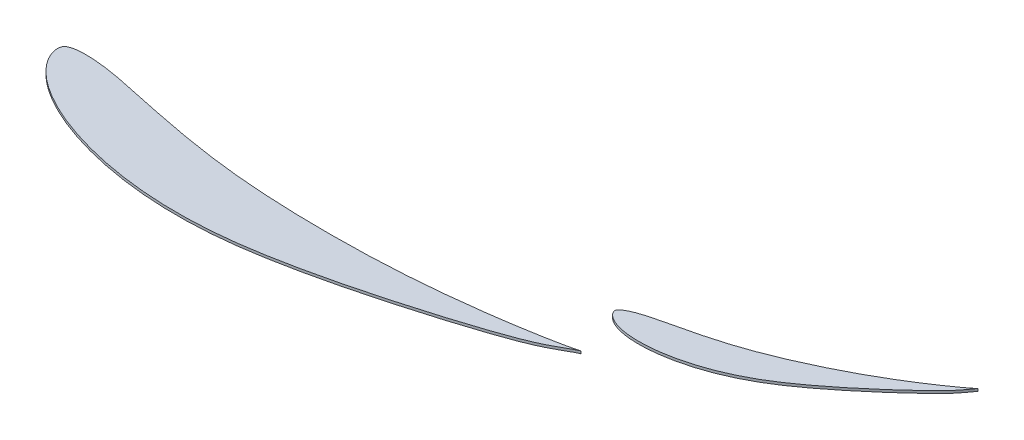
from build123d import *

# Parameters (mm, degrees)
BOSS_EXTRUDE1_DEPTH   = 2.54
BOSS_EXTRUDE1_2_DEPTH = 2.54


with BuildPart() as part:
    # Sketch1 → Boss-Extrude1 (new body)
    with BuildSketch(Plane(origin=(0, 0, 0), x_dir=(1, 0, 0), z_dir=(0, 1, 0))):
        with BuildLine():
            add(Edge.make_bspline(
                [(-65.525015137, 39.103844496), (-65.514133524, 39.05568373), (-69.330368116, 37.456695765), (-72.814827737, 35.400024606), (-80.7227079, 31.037480072), (-89.868707645, 26.057957443), (-101.665412949, 20.744641968), (-115.688692878, 15.412422669), (-131.983798166, 9.738777373), (-150.313770939, 3.751195379), (-170.420335762, -2.473211736), (-192.000742616, -8.83201937), (-214.756030556, -15.180686699), (-238.376616433, -21.382100922), (-262.560241869, -27.266919104), (-287.016180304, -32.63849534), (-311.456806383, -37.330221388), (-335.682843204, -41.100750357), (-359.591860952, -43.613190616), (-383.094018703, -44.822981977), (-406.104811997, -44.756753522), (-428.500260401, -43.467406892), (-450.149778579, -41.017205717), (-470.899931906, -37.493694507), (-490.597023577, -33.054648174), (-509.06491684, -27.812624595), (-526.129146123, -21.866271872), (-541.640457533, -15.334526653), (-555.466097949, -8.336922294), (-567.501002357, -1.005045574), (-577.656092521, 6.520797485), (-585.877200668, 14.082583746), (-592.133317539, 21.499736096), (-596.409495562, 28.59061136), (-598.575034728, 34.696788924), (-599.036000502, 38.911936925), (-598.790413989, 41.126303201), (-598.555902064, 42.207349962), (-598.30730175, 42.909543057), (-598.080648678, 43.431116307), (-597.879433561, 43.785850019), (-597.652549225, 44.115936175), (-597.368372032, 44.407883099), (-597.045817309, 44.681617567), (-596.556272794, 45.055826532), (-595.837030303, 45.476337957), (-594.68549791, 46.033652822), (-593.266785111, 46.559481046), (-589.524443937, 47.654977767), (-582.558240804, 48.420263236), (-571.538992553, 48.268320916), (-557.678707228, 46.802932901), (-540.902385572, 44.032003196), (-521.043703025, 39.934043609), (-497.975364102, 34.853408208), (-471.685857532, 29.503363101), (-442.487304973, 24.368315862), (-410.919097148, 19.902914985), (-377.698542245, 16.696153664), (-343.690278224, 14.870289275), (-309.66285138, 14.102695154), (-276.182981555, 14.264075254), (-243.757756932, 15.306649484), (-212.926276636, 17.226115366), (-184.210496541, 19.836057189), (-158.045252033, 22.833186658), (-134.732605243, 26.001109907), (-114.610260362, 29.129387533), (-97.62674733, 32.094851308), (-84.629317955, 34.52359059), (-74.100597026, 36.91804989), (-69.723451734, 37.82672261), (-65.536067747, 39.152762078), (-65.525015137, 39.103844496)],
                knots=[0, 0, 0, 0, 0.001812691, 0.006911328, 0.014576348, 0.024172143, 0.035572242, 0.04901308, 0.064512615, 0.081849281, 0.100772139, 0.120997345, 0.142228397, 0.164173399, 0.186536734, 0.209022727, 0.231367049, 0.253319655, 0.274803883, 0.295858285, 0.316448578, 0.336530716, 0.35603337, 0.374893008, 0.392989986, 0.410197087, 0.426388181, 0.441458696, 0.455334222, 0.467938119, 0.479235883, 0.48920359, 0.497850586, 0.505193934, 0.511308341, 0.515097163, 0.516441428, 0.517272652, 0.518060388, 0.518436362, 0.518797413, 0.519153544, 0.519507976, 0.519886846, 0.520288641, 0.521160208, 0.522116283, 0.523720315, 0.52521352, 0.532574604, 0.542380648, 0.554776211, 0.56993128, 0.588004893, 0.609187965, 0.63332852, 0.660001247, 0.688743434, 0.718873444, 0.749542513, 0.780126844, 0.81020899, 0.839387288, 0.867183376, 0.893104481, 0.916760447, 0.937874173, 0.956198632, 0.971543675, 0.983762849, 0.992691516, 0.998158824, 1, 1, 1, 1], degree=3))
        make_face()
    extrude(amount=BOSS_EXTRUDE1_DEPTH)


with BuildPart() as body_2:
    # Sketch1 → Boss-Extrude1 2 (new body)
    with BuildSketch(Plane(origin=(0, 0, 0), x_dir=(1, 0, 0), z_dir=(0, 1, 0))):
        with BuildLine():
            add(Edge.make_bspline(
                [(169.733247758, 207.983386826), (169.749075034, 207.962932217), (168.29135419, 206.359034959), (167.092455757, 204.611306059), (164.304069747, 200.78968467), (161.064489294, 196.401079283), (156.640424579, 191.267220946), (151.163516959, 185.631488248), (144.68368164, 179.33075216), (137.307324915, 172.430518466), (129.139988262, 165.024569359), (120.302723118, 157.228549359), (110.905458786, 149.177258141), (101.064811635, 141.004320502), (90.886785891, 132.857040447), (80.465867151, 124.893130772), (69.90171825, 117.255357897), (59.235515124, 110.102411292), (48.441306356, 103.616899454), (37.551878011, 97.839864775), (26.613242033, 92.777372437), (15.695966897, 88.431754036), (4.875829116, 84.80235886), (-5.754951025, 81.881592722), (-16.088481773, 79.628578806), (-26.016228156, 78.028873865), (-35.433527795, 77.074268125), (-44.243195815, 76.741339029), (-52.355748699, 77.002727944), (-59.692179096, 77.819224726), (-66.179138908, 79.143940906), (-71.755931111, 80.91384894), (-76.367859977, 83.050087542), (-79.967618787, 85.469733732), (-82.347404441, 87.889147001), (-83.499353456, 89.788170713), (-83.872963037, 90.893768531), (-84.000945481, 91.458890975), (-84.038372313, 91.847277981), (-84.046234137, 92.145060356), (-84.029238674, 92.358007318), (-83.99460093, 92.564935712), (-83.924321458, 92.766441172), (-83.831791201, 92.967796275), (-83.682227625, 93.253816678), (-83.433868963, 93.612666949), (-83.010572549, 94.132158932), (-82.45346663, 94.695849296), (-80.919366805, 96.044364927), (-77.781695099, 97.949789556), (-72.516862477, 100.317004764), (-65.61253739, 102.689608971), (-57.034864964, 105.087957162), (-46.700128627, 107.538667702), (-34.624127221, 110.233396301), (-20.959292738, 113.513301934), (-5.961033537, 117.539253863), (10.013937788, 122.407682856), (26.494705333, 128.239411642), (43.04373293, 134.901073615), (59.3675869, 142.069373139), (75.225849285, 149.557473555), (90.388365918, 157.230437236), (104.600161289, 164.966880491), (117.654713021, 172.562759553), (129.412729936, 179.777833421), (139.778716705, 186.44250492), (148.638939404, 192.382113524), (156.045098482, 197.549581254), (161.67774899, 201.579843143), (166.146011605, 205.047329587), (168.022831175, 206.447681285), (169.717171766, 208.004162867), (169.733247758, 207.983386826)],
                knots=[0, 0, 0, 0, 0.001812691, 0.006911328, 0.014576348, 0.024172143, 0.035572242, 0.04901308, 0.064512615, 0.081849281, 0.100772139, 0.120997345, 0.142228397, 0.164173399, 0.186536734, 0.209022727, 0.231367049, 0.253319655, 0.274803883, 0.295858285, 0.316448578, 0.336530716, 0.35603337, 0.374893008, 0.392989986, 0.410197087, 0.426388181, 0.441458696, 0.455334222, 0.467938119, 0.479235883, 0.48920359, 0.497850586, 0.505193934, 0.511308341, 0.515097163, 0.516441428, 0.517272652, 0.518060388, 0.518436362, 0.518797413, 0.519153544, 0.519507976, 0.519886846, 0.520288641, 0.521160208, 0.522116283, 0.523720315, 0.52521352, 0.532574604, 0.542380648, 0.554776211, 0.56993128, 0.588004893, 0.609187965, 0.63332852, 0.660001247, 0.688743434, 0.718873444, 0.749542513, 0.780126844, 0.81020899, 0.839387288, 0.867183376, 0.893104481, 0.916760447, 0.937874173, 0.956198632, 0.971543675, 0.983762849, 0.992691516, 0.998158824, 1, 1, 1, 1], degree=3))
        make_face()
    extrude(amount=BOSS_EXTRUDE1_2_DEPTH)


solid = Compound([part.part, body_2.part])
